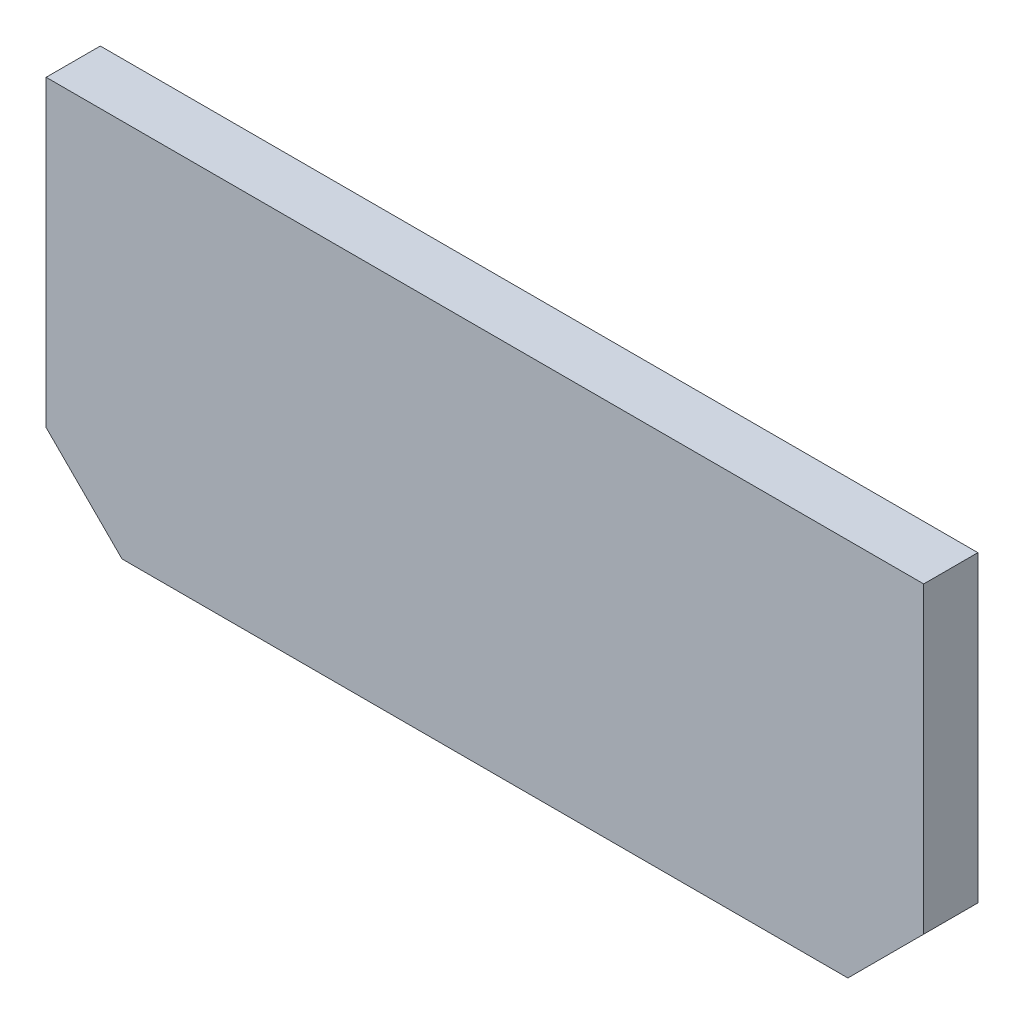
from build123d import *

# Parameters (mm, degrees)
SM_START                   = -2.5
SM_BASE_FLANGE_1_OUTLINE_W = 81
SM_BASE_FLANGE_1_OUTLINE_H = 35
SM_BASE_FLANGE_1_DEPTH     = 5
CHAMFER_1_SIZE             = 7


# Read off the part's stored shape, not the designer's step: Базовая кромка1
with BuildPart() as part:
    # Базовая кромка1 outline → Базовая кромка1 (new body)
    with BuildSketch(Plane.XY.offset(SM_START)):
        with Locations((0, 17.5)):
            Rectangle(SM_BASE_FLANGE_1_OUTLINE_W, SM_BASE_FLANGE_1_OUTLINE_H)
    extrude(amount=SM_BASE_FLANGE_1_DEPTH)

    # Фаска1
    chamfer_1_edges = [part.edges().sort_by_distance(p)[0] for p in [
        (40.5, 0, 0),
        (-40.5, 0, 0),
    ]]
    chamfer(chamfer_1_edges, length=CHAMFER_1_SIZE)


solid = part.part
